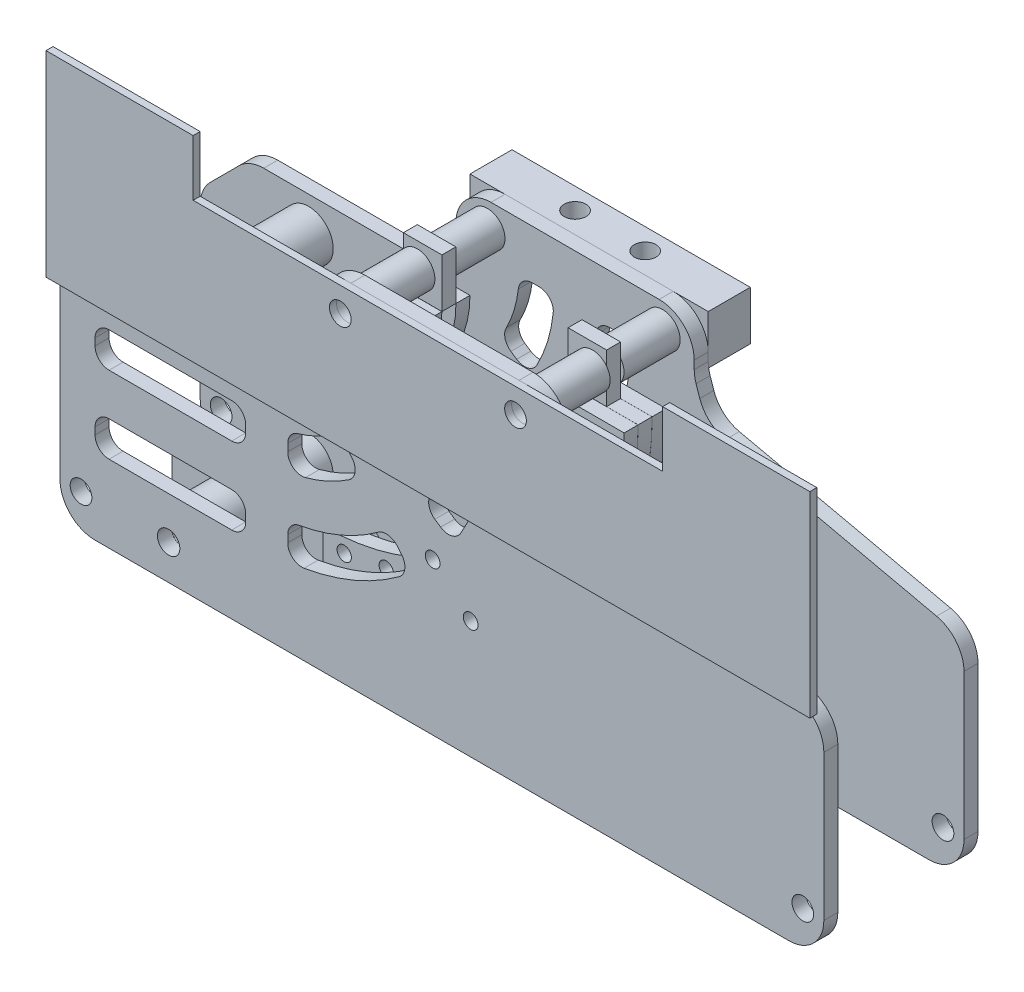
from build123d import *

# Parameters (mm, degrees)
SKETCH_2_R                = 1.025
SKETCH_2_R_2              = 1.25
EXTRUDE_1_DEPTH           = 3
EXTRUDE_1_2_DEPTH         = 3
EXTRUDE_START             = 9
SKETCH_5_R                = 1.55
EXTRUDE_2_DEPTH           = 2
SKETCH_7_W                = 5.5
SKETCH_7_H                = 7
SKETCH_7_W_2              = 23.5
SKETCH_7_H_2              = 10
EXTRUDE_3_DEPTH           = 1
CUT_EXTRUDE_4_DEPTH       = 91.178988684
CUT_EXTRUDE_4_DEPTH_BACK  = 91.178988684
SKETCH_10_R               = 1.6
EXTRUDE_START_2           = -20
SKETCH_11_R               = 3.5
SKETCH_11_R_2             = 1.6
EXTRUDE_4_DEPTH           = 18
CUT_EXTRUDE_7_DEPTH       = 91.178988684
CUT_EXTRUDE_7_DEPTH_BACK  = 91.178988684
SKETCH_6_W                = 242.944287764
SKETCH_6_H                = 0.01
SKETCH_6_W_2              = 242.219741481
SKETCH_6_W_3              = 238.330036414
CUT_EXTRUDE_8_DEPTH       = 1
CUT_EXTRUDE_9_DEPTH       = 91.178988684
CUT_EXTRUDE_9_DEPTH_BACK  = 100.178988684
CUT_EXTRUDE_9_START       = 9
SKETCH_18_R               = 1.55
SKETCH_19_R               = 2.5
SKETCH_19_R_2             = 1.55
EXTRUDE_9_DEPTH           = 8
EXTRUDE_9_2_DEPTH         = 8
EXTRUDE_START_3           = 9.99
SKETCH_19_2_R             = 2.5
SKETCH_19_2_R_2           = 1.55
EXTRUDE_10_DEPTH          = 8.01
EXTRUDE_10_2_DEPTH        = 8.01
SKETCH_20_W               = 38
SKETCH_20_H               = 7
SKETCH_20_R               = 1.2
EXTRUDE_11_DEPTH          = 6
SKETCH_21_R               = 1.55
CUT_EXTRUDE_10_DEPTH      = 92.105707834
CUT_EXTRUDE_START         = -29
CUT_EXTRUDE_11_OUTLINE_W  = 2
CUT_EXTRUDE_11_OUTLINE_H  = 7
CUT_EXTRUDE_11_DEPTH      = 8
CUT_EXTRUDE_START_2       = -23
CUT_EXTRUDE_11_2_DEPTH    = 4
CUT_EXTRUDE_START_3       = -3
CUT_EXTRUDE_11_3_DEPTH    = 4
CUT_EXTRUDE_12_DEPTH      = 94.782994194
CUT_EXTRUDE_12_DEPTH_BACK = 94.782994194
SKETCH_23_R               = 1.05
SKETCH_25_W               = 21.5
SKETCH_25_H               = 5
CUT_EXTRUDE_13_DEPTH      = 94.782994194
SKETCH_25_3_W             = 21.5
SKETCH_25_3_H             = 5
CUT_EXTRUDE_16_DEPTH      = 94.782994194
FILLET_6_R                = 2
FILLET_7_R                = 2
EXTRUDE_14_DEPTH          = 15
SKETCH_28_R               = 1.15
CUT_EXTRUDE_15_DEPTH      = 15
CUT_EXTRUDE_17_DEPTH      = 2
FILLET_8_R                = 1
SKETCH_30_R               = 1.55
EXTRUDE_15_DEPTH          = 1
CUT_EXTRUDE_START_4       = -17
SKETCH_31_R               = 1.6
CUT_EXTRUDE_18_DEPTH      = 17
SKETCH_32_W               = 9
SKETCH_32_H               = 9
CUT_EXTRUDE_19_DEPTH      = 95.740097074
SKETCH_33_W               = 7
SKETCH_33_H               = 10
CUT_EXTRUDE_20_DEPTH      = 1.99
CUT_EXTRUDE_21_DEPTH      = 95.740097046
CUT_EXTRUDE_21_DEPTH_BACK = 95.740097046
SKETCH_34_W               = 1
SKETCH_34_H               = 32
EXTRUDE_16_DEPTH          = 2
EXTRUDE_START_4           = -9
EXTRUDE_17_DEPTH          = 2
FILLET_9_R                = 5
FILLET_10_R               = 5


with BuildPart() as part:
    # 草图2 → 凸台-拉伸1 (new, symmetric)
    with BuildSketch(Plane.XY):
        with BuildLine():
            Line((0, -5), (0, -15))
            ThreePointArc((0, -15), (10.606601718, -10.606601718), (15, 0))
            Line((15, 0), (5, 0))
            ThreePointArc((5, 0), (3.535533906, -3.535533906), (0, -5))
        make_face()
        with Locations((12.291741483, -4.232386008)):
            Circle(SKETCH_2_R, mode=Mode.SUBTRACT)
        with Locations((9.507598121, -8.865978681)):
            Circle(SKETCH_2_R, mode=Mode.SUBTRACT)
        with Locations((5.07950467, -11.966563095)):
            Circle(SKETCH_2_R, mode=Mode.SUBTRACT)
        with Locations((3.5, -7.745966692)):
            Circle(SKETCH_2_R_2, mode=Mode.SUBTRACT)
        with Locations((7.745966692, -3.5)):
            Circle(SKETCH_2_R_2, mode=Mode.SUBTRACT)
    extrude(amount=EXTRUDE_1_DEPTH, both=True)



with BuildPart() as body_2:
    # 草图2 → Extrude 1 2 (new, symmetric)
    with BuildSketch(Plane.XY):
        with BuildLine():
            Line((33, 0), (43, 0))
            ThreePointArc((43, 0), (30.405591591, -30.405591591), (0, -43))
            Line((0, -43), (0, -33))
            ThreePointArc((0, -33), (23.334523779, -23.334523779), (33, 0))
        make_face()
        with Locations((34.866814433, -3.050450996)):
            Circle(SKETCH_2_R, mode=Mode.SUBTRACT)
        with Locations((33.80740392, -9.058666579)):
            Circle(SKETCH_2_R, mode=Mode.SUBTRACT)
        with Locations((31.720772546, -14.791639161)):
            Circle(SKETCH_2_R, mode=Mode.SUBTRACT)
        with Locations((28.67032155, -20.075175272)):
            Circle(SKETCH_2_R, mode=Mode.SUBTRACT)
        with Locations((24.748737342, -24.748737342)):
            Circle(SKETCH_2_R, mode=Mode.SUBTRACT)
        with Locations((20.075175272, -28.67032155)):
            Circle(SKETCH_2_R, mode=Mode.SUBTRACT)
        with Locations((14.791639161, -31.720772546)):
            Circle(SKETCH_2_R, mode=Mode.SUBTRACT)
        with Locations((9.058666579, -33.80740392)):
            Circle(SKETCH_2_R, mode=Mode.SUBTRACT)
        with Locations((3.050450996, -34.866814433)):
            Circle(SKETCH_2_R, mode=Mode.SUBTRACT)
        with Locations((7, -39.382737335)):
            Circle(SKETCH_2_R_2, mode=Mode.SUBTRACT)
        with Locations((39.382737335, -7)):
            Circle(SKETCH_2_R_2, mode=Mode.SUBTRACT)
        with Locations((31.382737335, -24.801689405)):
            Circle(SKETCH_2_R_2, mode=Mode.SUBTRACT)
    extrude(amount=EXTRUDE_1_2_DEPTH, both=True)


with BuildPart() as body_3:
    # 草图5 → 凸台-拉伸2 (new body)
    with BuildSketch(Plane.XY.offset(EXTRUDE_START)):
        with BuildLine():
            Line((-22.5, -5), (0, -5))
            ThreePointArc((0, -5), (3.535533906, -3.535533906), (5, 0))
            Line((5, 0), (5, 7))
            Line((5, 7), (43, 7))
            Line((43, 7), (43, 0))
            ThreePointArc((43, 0), (42.927016315, -2.504250452), (42.708313008, -5))
            Line((42.708313008, -5), (78.5, -13))
            Line((78.5, -13), (78.5, -43))
            Line((78.5, -43), (-30.5, -43))
            Line((-30.5, -43), (-30.5, -13))
            Line((-30.5, -13), (-22.5, -5))
        make_face()
        with Locations((-26.5, -38)):
            Circle(SKETCH_5_R, mode=Mode.SUBTRACT)
        with Locations((76.5, -38)):
            Circle(SKETCH_5_R, mode=Mode.SUBTRACT)
    extrude(amount=EXTRUDE_2_DEPTH)


with BuildPart() as body_4:
    # 镜向8: mirrored copy
    add(body_3.part.mirror(Plane.XY))


with BuildPart() as part_1:
    add(part.part)

    add(body_2.part)  # 凸台-拉伸3 merges body 2
    # 草图7 → 凸台-拉伸3 (add, symmetric)
    with BuildSketch(Plane.XY):
        with Locations((12.25, 3.5)):
            Rectangle(SKETCH_7_W, SKETCH_7_H)
        Polygon((0, -15), (-23.5, -15), (-30.5, -15), (-30.5, -5), (-23.5, -5), (0, -5), align=None)
        with Locations((-11.75, -38)):
            Rectangle(SKETCH_7_W_2, SKETCH_7_H_2)
        with Locations((35.75, 3.5)):
            Rectangle(SKETCH_7_W, SKETCH_7_H)
    extrude(amount=EXTRUDE_3_DEPTH, both=True)


with BuildPart() as cut_extrude_4_tool:
    # 草图10 → 切除-拉伸4 (new, two sides: drawn at the far end of the back side and taken through both)
    with BuildSketch(Plane.XY.offset(-CUT_EXTRUDE_4_DEPTH_BACK)):
        with Locations((-14, -10)):
            Circle(SKETCH_10_R)
        with Locations((-14, -38)):
            Circle(SKETCH_10_R)
    extrude(amount=CUT_EXTRUDE_4_DEPTH + CUT_EXTRUDE_4_DEPTH_BACK)


with BuildPart() as part_2:
    add(part_1.part)

    # 切除-拉伸4: cut by cut_extrude_4_tool
    add(cut_extrude_4_tool.part, mode=Mode.SUBTRACT)



with BuildPart() as body_3_1:
    add(body_3.part)

    # 切除-拉伸4: cut by cut_extrude_4_tool
    add(cut_extrude_4_tool.part, mode=Mode.SUBTRACT)


with BuildPart() as body_4_1:
    add(body_4.part)

    # 切除-拉伸4: cut by cut_extrude_4_tool
    add(cut_extrude_4_tool.part, mode=Mode.SUBTRACT)


with BuildPart() as part_3:
    add(part_2.part)

    add(body_3_1.part)  # 凸台-拉伸4 merges body 3

    add(body_4_1.part)  # 凸台-拉伸4 merges body 4
    # 草图11 → 凸台-拉伸4 (add)
    # profile 1 of 2: a face of its own
    with BuildSketch(Plane.XY.offset(11).offset(EXTRUDE_START_2)):
        with Locations((-14, -10)):
            Circle(SKETCH_11_R)
        with Locations((-14, -10)):
            Circle(SKETCH_11_R_2, mode=Mode.SUBTRACT)
    # profile 2 of 2: a face of its own
    with BuildSketch(Plane.XY.offset(11).offset(EXTRUDE_START_2)):
        with Locations((-14, -38)):
            Circle(SKETCH_11_R)
        with Locations((-14, -38)):
            Circle(SKETCH_11_R_2, mode=Mode.SUBTRACT)
    extrude(amount=EXTRUDE_4_DEPTH)

    # 草图6 → 切除-拉伸7 (cut, two sides: drawn at the far end of the back side and taken through both)
    with BuildSketch(Plane(origin=(0, 0, 0), x_dir=(1, 0, 0), z_dir=(0, 1, 0)).offset(-CUT_EXTRUDE_7_DEPTH_BACK)):
        with Locations((30.547592509, -8.995)):
            Rectangle(SKETCH_6_W, SKETCH_6_H)
        with Locations((30.909865651, 8.995)):
            Rectangle(SKETCH_6_W_2, SKETCH_6_H)
        with Locations((32.854718184, 0.995)):
            Rectangle(SKETCH_6_W_3, SKETCH_6_H)
        with Locations((32.854718184, -1.005)):
            Rectangle(SKETCH_6_W_3, SKETCH_6_H)
    extrude(amount=CUT_EXTRUDE_7_DEPTH + CUT_EXTRUDE_7_DEPTH_BACK, mode=Mode.SUBTRACT)


with BuildPart() as cut_extrude_7_piece_1:
    # of the separate pieces the step leaves, piece 1, a body of its own (cut_extrude_7_pieces)
    add(part_3.part.solids().sort_by_distance((-22.5, -5, 9))[0])


with BuildPart() as cut_extrude_7_piece_2:
    # of the separate pieces the step leaves, piece 2, a body of its own (cut_extrude_7_pieces)
    add(part_3.part.solids().sort_by_distance((-12.4, -38, -9))[0])


with BuildPart() as cut_extrude_7_piece_3:
    # of the separate pieces the step leaves, piece 3, a body of its own (cut_extrude_7_pieces)
    add(part_3.part.solids().sort_by_distance((0, -43, 1))[0])


with BuildPart() as cut_extrude_7_piece_4:
    # of the separate pieces the step leaves, piece 4, a body of its own (cut_extrude_7_pieces)
    add(part_3.part.solids().sort_by_distance((43, 0, -3))[0])


with BuildPart() as cut_extrude_7_piece_5:
    # of the separate pieces the step leaves, piece 5, a body of its own (cut_extrude_7_pieces)
    add(part_3.part.solids().sort_by_distance((0, -43, 1.01))[0])


with BuildPart() as cut_extrude_7_piece_6:
    # of the separate pieces the step leaves, piece 6, a body of its own (cut_extrude_7_pieces)
    add(part_3.part.solids().sort_by_distance((0, -15, 1))[0])


with BuildPart() as cut_extrude_7_piece_7:
    # of the separate pieces the step leaves, piece 7, a body of its own (cut_extrude_7_pieces)
    add(part_3.part.solids().sort_by_distance((0, -15, -1))[0])


with BuildPart() as cut_extrude_7_piece_8:
    # of the separate pieces the step leaves, piece 8, a body of its own (cut_extrude_7_pieces)
    add(part_3.part.solids().sort_by_distance((0, -5, 1.01))[0])


with BuildPart() as cut_extrude_7_piece_9:
    # of the separate pieces the step leaves, piece 9, a body of its own (cut_extrude_7_pieces)
    add(part_3.part.solids().sort_by_distance((-12.4, -38, -1))[0])


with BuildPart() as cut_extrude_7_piece_10:
    # of the separate pieces the step leaves, piece 10, a body of its own (cut_extrude_7_pieces)
    add(part_3.part.solids().sort_by_distance((-10.5, -10, -8.99))[0])


with BuildPart() as cut_extrude_7_piece_11:
    # of the separate pieces the step leaves, piece 11, a body of its own (cut_extrude_7_pieces)
    add(part_3.part.solids().sort_by_distance((-10.5, -38, 1.01))[0])


with BuildPart() as cut_extrude_7_piece_12:
    # of the separate pieces the step leaves, piece 12, a body of its own (cut_extrude_7_pieces)
    add(part_3.part.solids().sort_by_distance((-10.5, -10, 1.01))[0])


with BuildPart() as cut_extrude_8_tool:
    # 草图8 → 切除-拉伸8 (new, symmetric)
    with BuildSketch(Plane.XY):
        with BuildLine():
            Line((10, 0), (15, 0))
            ThreePointArc((15, 0), (10.606601718, -10.606601718), (0, -15))
            Line((0, -15), (0, -10))
            ThreePointArc((0, -10), (7.071067812, -7.071067812), (10, 0))
        make_face()
        with BuildLine():
            Line((0, -38), (0, -33))
            ThreePointArc((0, -33), (23.334523779, -23.334523779), (33, 0))
            Line((33, 0), (38, 0))
            ThreePointArc((38, 0), (26.870057685, -26.870057685), (0, -38))
        make_face()
    extrude(amount=CUT_EXTRUDE_8_DEPTH, both=True)


with BuildPart() as cut_extrude_7_piece_3_1:
    add(cut_extrude_7_piece_3.part)

    # 切除-拉伸8: cut by cut_extrude_8_tool
    add(cut_extrude_8_tool.part, mode=Mode.SUBTRACT)


with BuildPart() as cut_extrude_7_piece_6_1:
    add(cut_extrude_7_piece_6.part)

    # 切除-拉伸8: cut by cut_extrude_8_tool
    add(cut_extrude_8_tool.part, mode=Mode.SUBTRACT)


with BuildPart() as cut_extrude_9_tool:
    # 草图18 → 切除-拉伸9 (new, two sides: drawn at the far end of the back side and taken through both)
    with BuildSketch(Plane.XY.offset(CUT_EXTRUDE_9_START - CUT_EXTRUDE_9_DEPTH_BACK)):
        with Locations((11.5, 3.5)):
            Circle(SKETCH_18_R)
        with Locations((36.5, 3.5)):
            Circle(SKETCH_18_R)
    extrude(amount=CUT_EXTRUDE_9_DEPTH + CUT_EXTRUDE_9_DEPTH_BACK)


with BuildPart() as cut_extrude_7_piece_1_1:
    add(cut_extrude_7_piece_1.part)

    # 切除-拉伸9: cut by cut_extrude_9_tool
    add(cut_extrude_9_tool.part, mode=Mode.SUBTRACT)

    # Cut-Extrude 11 3 outline → Cut-Extrude 11 3 (cut)
    with BuildSketch(Plane.XY.offset(11).offset(CUT_EXTRUDE_START_3)):
        with BuildLine():
            Line((43, 7), (41, 7))
            Line((41, 7), (41, 0))
            Line((41, 0), (42.708313008, -5))
            ThreePointArc((42.708313008, -5), (42.927016315, -2.504250452), (43, 0))
            Line((43, 0), (43, 7))
        make_face()
        with BuildLine():
            Line((7, 0), (7, 7))
            Line((7, 7), (5, 7))
            Line((5, 7), (5, 0))
            ThreePointArc((5, 0), (4.638584663, -1.866422334), (3.606587069, -3.463023205))
            Line((3.606587069, -3.463023205), (7, 0))
        make_face()
    extrude(amount=CUT_EXTRUDE_11_3_DEPTH, mode=Mode.SUBTRACT)


with BuildPart() as cut_extrude_7_piece_2_1:
    add(cut_extrude_7_piece_2.part)

    # 切除-拉伸9: cut by cut_extrude_9_tool
    add(cut_extrude_9_tool.part, mode=Mode.SUBTRACT)

    # Cut-Extrude 11 2 outline → Cut-Extrude 11 2 (cut)
    with BuildSketch(Plane.XY.offset(11).offset(CUT_EXTRUDE_START_2)):
        with BuildLine():
            Line((43, 7), (41, 7))
            Line((41, 7), (41, 0))
            Line((41, 0), (42.708313008, -5))
            ThreePointArc((42.708313008, -5), (42.927016315, -2.504250452), (43, 0))
            Line((43, 0), (43, 7))
        make_face()
        with BuildLine():
            Line((7, 0), (7, 7))
            Line((7, 7), (5, 7))
            Line((5, 7), (5, 0))
            ThreePointArc((5, 0), (4.638584663, -1.866422334), (3.606587069, -3.463023205))
            Line((3.606587069, -3.463023205), (7, 0))
        make_face()
    extrude(amount=CUT_EXTRUDE_11_2_DEPTH, mode=Mode.SUBTRACT)


with BuildPart() as cut_extrude_7_piece_3_2:
    add(cut_extrude_7_piece_3_1.part)

    # 切除-拉伸9: cut by cut_extrude_9_tool
    add(cut_extrude_9_tool.part, mode=Mode.SUBTRACT)


with BuildPart() as cut_extrude_7_piece_6_2:
    add(cut_extrude_7_piece_6_1.part)

    # 切除-拉伸9: cut by cut_extrude_9_tool
    add(cut_extrude_9_tool.part, mode=Mode.SUBTRACT)

    # 草图33 → 切除-拉伸20 (cut)
    with BuildSketch(Plane.XY.offset(1)):
        with Locations((-27, -10)):
            Rectangle(SKETCH_33_W, SKETCH_33_H)
    extrude(amount=-CUT_EXTRUDE_20_DEPTH, mode=Mode.SUBTRACT)


with BuildPart() as body_13:
    # 草图19 → 凸台-拉伸9 (new body)
    with BuildSketch(Plane(origin=(0, 0, 9), x_dir=(-1, 0, 0), z_dir=(0, 0, -1))):
        with Locations((-11.5, 3.5)):
            Circle(SKETCH_19_R)
        with Locations((-11.5, 3.5)):
            Circle(SKETCH_19_R_2, mode=Mode.SUBTRACT)
    extrude(amount=EXTRUDE_9_DEPTH)


with BuildPart() as body_14:
    # 草图19 → Extrude 9 2 (new body)
    with BuildSketch(Plane(origin=(0, 0, 9), x_dir=(-1, 0, 0), z_dir=(0, 0, -1))):
        with Locations((-36.5, 3.5)):
            Circle(SKETCH_19_R)
        with Locations((-36.5, 3.5)):
            Circle(SKETCH_19_R_2, mode=Mode.SUBTRACT)
    extrude(amount=EXTRUDE_9_2_DEPTH)


with BuildPart() as body_15:
    # 草图19<2> → 凸台-拉伸10 (new body)
    with BuildSketch(Plane(origin=(0, 0, 9), x_dir=(-1, 0, 0), z_dir=(0, 0, -1)).offset(EXTRUDE_START_3)):
        with Locations(Location((-11.5, 3.5, 0), (0, 0, 180))):
            Circle(SKETCH_19_2_R)
        with Locations(Location((-11.5, 3.5, 0), (0, 0, 180))):
            Circle(SKETCH_19_2_R_2, mode=Mode.SUBTRACT)
    extrude(amount=EXTRUDE_10_DEPTH)


with BuildPart() as body_16:
    # 草图19<2> → Extrude 10 2 (new body)
    with BuildSketch(Plane(origin=(0, 0, 9), x_dir=(-1, 0, 0), z_dir=(0, 0, -1)).offset(EXTRUDE_START_3)):
        with Locations(Location((-36.5, 3.5, 0), (0, 0, 180))):
            Circle(SKETCH_19_2_R)
        with Locations(Location((-36.5, 3.5, 0), (0, 0, 180))):
            Circle(SKETCH_19_2_R_2, mode=Mode.SUBTRACT)
    extrude(amount=EXTRUDE_10_2_DEPTH)


with BuildPart() as body_17:
    # 草图20 → 凸台-拉伸11 (new body)
    with BuildSketch(Plane(origin=(0, 0, -11), x_dir=(-1, 0, 0), z_dir=(0, 0, -1))):
        with Locations((-24, 3.5)):
            Rectangle(SKETCH_20_W, SKETCH_20_H)
        with Locations((-11.5, 3.5)):
            Circle(SKETCH_20_R, mode=Mode.SUBTRACT)
        with Locations((-36.5, 3.5)):
            Circle(SKETCH_20_R, mode=Mode.SUBTRACT)
    extrude(amount=EXTRUDE_11_DEPTH)

    # 草图21 → 切除-拉伸10 (cut, through all)
    with BuildSketch(Plane.XZ):
        with Locations(Location((19, -14, 0), (0, 0, 270))):
            Circle(SKETCH_21_R)
        with Locations(Location((29, -14, 0), (0, 0, 90))):
            Circle(SKETCH_21_R)
    extrude(amount=-CUT_EXTRUDE_10_DEPTH, mode=Mode.SUBTRACT)

    # 切除-拉伸11: read off the stored shape, not the designer's step
    # 切除-拉伸11 outline → 切除-拉伸11 (cut)
    with BuildSketch(Plane.XY.offset(11).offset(CUT_EXTRUDE_START)):
        with Locations((6, 3.5)):
            Rectangle(CUT_EXTRUDE_11_OUTLINE_W, CUT_EXTRUDE_11_OUTLINE_H)
        with Locations((42, 3.5)):
            Rectangle(CUT_EXTRUDE_11_OUTLINE_W, CUT_EXTRUDE_11_OUTLINE_H)
    extrude(amount=CUT_EXTRUDE_11_DEPTH, mode=Mode.SUBTRACT)


with BuildPart() as cut_extrude_12_tool:
    # 草图23 → 切除-拉伸12 (new, two sides: drawn at the far end of the back side and taken through both)
    with BuildSketch(Plane.XY.offset(11).offset(-CUT_EXTRUDE_12_DEPTH_BACK)):
        with Locations(Location((29.102644739, -26.186992366, 0), (0, 0, 180))):
            Circle(SKETCH_23_R)
        with Locations(Location((23.676097955, -21.304104901, 0), (0, 0, 180))):
            Circle(SKETCH_23_R)
    extrude(amount=CUT_EXTRUDE_12_DEPTH + CUT_EXTRUDE_12_DEPTH_BACK)


with BuildPart() as cut_extrude_7_piece_1_2:
    add(cut_extrude_7_piece_1_1.part)

    # 切除-拉伸12: cut by cut_extrude_12_tool
    add(cut_extrude_12_tool.part, mode=Mode.SUBTRACT)

    # 草图25 → 切除-拉伸13 (cut, through all)
    with BuildSketch(Plane.XY.offset(11)):
        with BuildLine():
            Line((13.267512535, -8.942768651), (17.413610202, -11.737383854))
            ThreePointArc((17.413610202, -11.737383854), (20.083398794, -6.136537532), (21, 0))
            Line((21, 0), (16, 0))
            ThreePointArc((16, 0), (15.301637176, -4.675457167), (13.267512535, -8.942768651))
        make_face()
        with BuildLine():
            ThreePointArc((27, 0), (25.821512735, -7.88983397), (22.388927402, -15.090922098))
            Line((22.388927402, -15.090922098), (26.535025069, -17.885537302))
            ThreePointArc((26.535025069, -17.885537302), (30.603274353, -9.350914334), (32, 0))
            Line((32, 0), (27, 0))
        make_face()
        with BuildLine():
            ThreePointArc((17.361996461, -20.677550118), (10.636002475, -24.816838061), (3, -26.83281573))
            Line((3, -26.83281573), (3, -31.859064644))
            ThreePointArc((3, -31.859064644), (12.348485191, -29.521431427), (20.577180991, -24.506726066))
            Line((20.577180991, -24.506726066), (17.361996461, -20.677550118))
        make_face()
        with BuildLine():
            Line((3, -15.716233646), (3, -20.784609691))
            ThreePointArc((3, -20.784609691), (8.580268921, -19.167132943), (13.503775025, -16.082538981))
            Line((13.503775025, -16.082538981), (10.288590495, -12.253363033))
            ThreePointArc((10.288590495, -12.253363033), (6.866187265, -14.45183284), (3, -15.716233646))
        make_face()
        with Locations((-13.75, -29.5)):
            Rectangle(SKETCH_25_W, SKETCH_25_H)
        with Locations((-13.75, -18.5)):
            Rectangle(SKETCH_25_W, SKETCH_25_H)
    extrude(amount=-CUT_EXTRUDE_13_DEPTH, mode=Mode.SUBTRACT)

    # 圆角6
    fillet_6_edges = [cut_extrude_7_piece_1_2.edges().sort_by_distance(p)[0] for p in [
        (-24.5, -27, 10),
        (-3, -27, 10),
        (-3, -32, 10),
        (-24.5, -32, 10),
        (3, -15.716233646, 10),
        (10.288590495, -12.253363033, 10),
        (13.503775025, -16.082538981, 10),
        (3, -20.784609691, 10),
        (3, -31.859064644, 10),
        (3, -26.83281573, 10),
        (17.361996461, -20.677550118, 10),
        (20.577180991, -24.506726066, 10),
        (26.535025069, -17.885537302, 10),
        (22.388927402, -15.090922098, 10),
        (27, 0, 10),
        (32, 0, 10),
        (-24.5, -16, 10),
        (-3, -16, 10),
        (-3, -21, 10),
        (-24.5, -21, 10),
        (13.267512535, -8.942768651, 10),
        (16, 0, 10),
        (21, 0, 10),
        (17.413610202, -11.737383854, 10),
    ]]
    fillet(fillet_6_edges, radius=FILLET_6_R)


with BuildPart() as cut_extrude_7_piece_2_2:
    add(cut_extrude_7_piece_2_1.part)

    # 切除-拉伸12: cut by cut_extrude_12_tool
    add(cut_extrude_12_tool.part, mode=Mode.SUBTRACT)

    # 草图25<3> → 切除-拉伸16 (cut, through all)
    with BuildSketch(Plane.XY.offset(11)):
        with Locations((-13.75, -18.5)):
            Rectangle(SKETCH_25_3_W, SKETCH_25_3_H)
        with Locations((-13.75, -29.5)):
            Rectangle(SKETCH_25_3_W, SKETCH_25_3_H)
        with BuildLine():
            Line((13.267512535, -8.942768651), (17.413610202, -11.737383854))
            ThreePointArc((17.413610202, -11.737383854), (20.083398794, -6.136537532), (21, 0))
            Line((21, 0), (16, 0))
            ThreePointArc((16, 0), (15.301637176, -4.675457167), (13.267512535, -8.942768651))
        make_face()
        with BuildLine():
            ThreePointArc((27, 0), (25.821512735, -7.88983397), (22.388927402, -15.090922098))
            Line((22.388927402, -15.090922098), (26.535025069, -17.885537302))
            ThreePointArc((26.535025069, -17.885537302), (30.603274353, -9.350914334), (32, 0))
            Line((32, 0), (27, 0))
        make_face()
    extrude(amount=-CUT_EXTRUDE_16_DEPTH, mode=Mode.SUBTRACT)

    # 圆角7
    fillet_7_edges = [cut_extrude_7_piece_2_2.edges().sort_by_distance(p)[0] for p in [
        (26.535025069, -17.885537302, -10),
        (22.388927402, -15.090922098, -10),
        (27, 0, -10),
        (32, 0, -10),
        (13.267512535, -8.942768651, -10),
        (16, 0, -10),
        (21, 0, -10),
        (17.413610202, -11.737383854, -10),
        (-24.5, -27, -10),
        (-3, -27, -10),
        (-3, -32, -10),
        (-24.5, -32, -10),
        (-24.5, -16, -10),
        (-3, -16, -10),
        (-3, -21, -10),
        (-24.5, -21, -10),
    ]]
    fillet(fillet_7_edges, radius=FILLET_7_R)

    # 草图29 → 切除-拉伸17 (cut)
    with BuildSketch(Plane(origin=(0, 0, -11), x_dir=(-1, 0, 0), z_dir=(0, 0, -1))):
        Polygon((-16.061771025, -20.669530995), (-13.745594554, -17.165914783), (-7.906234202, -21.026208901), (-10.222410673, -24.529825112), align=None)
    extrude(amount=-CUT_EXTRUDE_17_DEPTH, mode=Mode.SUBTRACT)

    # 圆角8
    fillet_8_edges = [cut_extrude_7_piece_2_2.edges().sort_by_distance(p)[0] for p in [
        (10.222410673, -24.529825112, -10),
        (16.061771025, -20.669530995, -10),
        (13.745594554, -17.165914783, -10),
        (7.906234202, -21.026208901, -10),
    ]]
    fillet(fillet_8_edges, radius=FILLET_8_R)


with BuildPart() as body_18:
    # 草图27 → 凸台-拉伸14 (new body)
    with BuildSketch(Plane(origin=(0, 0, -11), x_dir=(-1, 0, 0), z_dir=(0, 0, -1))):
        Polygon((1.683886721, -33.719497705), (-15, -22.690085941), (-23.272058824, -35.203000982), (-6.588172102, -46.232412746), align=None)
    extrude(amount=EXTRUDE_14_DEPTH)

    # 草图28 → 切除-拉伸15 (cut)
    with BuildSketch(Plane(origin=(23.272058824, -35.203000982, 0), x_dir=(0, 0, -1), z_dir=(0.5514705882352942, -0.8341943360581028, 0))):
        with Locations(Location((22.7, -14, 0), (0, 0, 90))):
            Circle(SKETCH_28_R)
        with Locations(Location((22.7, -4.5, 0), (0, 0, 90))):
            Circle(SKETCH_28_R)
    extrude(amount=-CUT_EXTRUDE_15_DEPTH, mode=Mode.SUBTRACT)


with BuildPart() as body_19:
    # 草图30 → 凸台-拉伸15 (new body)
    with BuildSketch(Plane.XY.offset(11)):
        Polygon((-9.5, 7), (57.5, 7), (57.5, 15), (78.5, 15), (78.5, 7), (78.5, -13), (-30.5, -13), (-30.5, 7), (-30.5, 15), (-9.5, 15), align=None)
        with Locations((36.5, 3.5)):
            Circle(SKETCH_30_R, mode=Mode.SUBTRACT)
        with Locations((11.5, 3.5)):
            Circle(SKETCH_30_R, mode=Mode.SUBTRACT)
    extrude(amount=EXTRUDE_15_DEPTH)


with BuildPart() as cut_extrude_18_tool:
    # 草图31 → 切除-拉伸18 (new body)
    with BuildSketch(Plane(origin=(0, 0, -26), x_dir=(-1, 0, 0), z_dir=(0, 0, -1)).offset(CUT_EXTRUDE_START_4)):
        with Locations((-17.446675379, -35.457770915)):
            Circle(SKETCH_31_R)
        with Locations((-9.104732018, -40.972476797)):
            Circle(SKETCH_31_R)
    extrude(amount=CUT_EXTRUDE_18_DEPTH)


with BuildPart() as cut_extrude_7_piece_2_3:
    add(cut_extrude_7_piece_2_2.part)

    # 切除-拉伸18: cut by cut_extrude_18_tool
    add(cut_extrude_18_tool.part, mode=Mode.SUBTRACT)


with BuildPart() as body_18_1:
    add(body_18.part)

    # 切除-拉伸18: cut by cut_extrude_18_tool
    add(cut_extrude_18_tool.part, mode=Mode.SUBTRACT)

    # 草图32 → 切除-拉伸19 (cut, through all)
    with BuildSketch(Plane(origin=(0, 0, 0), x_dir=(0, 0, -1), z_dir=(0.8341943360581027, 0.5514705882352942, 0))):
        with Locations((21.5, -37.7)):
            Rectangle(SKETCH_32_W, SKETCH_32_H)
    extrude(amount=-CUT_EXTRUDE_19_DEPTH, mode=Mode.SUBTRACT)


with BuildPart() as cut_extrude_21_tool:
    # 草图34 → 切除-拉伸21 (new, two sides: drawn at the far end of the back side and taken through both)
    with BuildSketch(Plane.XY.offset(-CUT_EXTRUDE_21_DEPTH_BACK)):
        with Locations((-30, -27)):
            Rectangle(SKETCH_34_W, SKETCH_34_H)
    extrude(amount=CUT_EXTRUDE_21_DEPTH + CUT_EXTRUDE_21_DEPTH_BACK)


with BuildPart() as cut_extrude_7_piece_1_3:
    add(cut_extrude_7_piece_1_2.part)

    # 切除-拉伸21: cut by cut_extrude_21_tool
    add(cut_extrude_21_tool.part, mode=Mode.SUBTRACT)

    # 草图35 → 凸台-拉伸16 (add)
    with BuildSketch(Plane.XY.offset(EXTRUDE_START)):
        Polygon((78.5, -43), (78.5, -13), (79.5, -13.223515589), (79.5, -43), align=None)
    extrude(amount=EXTRUDE_16_DEPTH)

    # 圆角9
    fillet_9_edges = [cut_extrude_7_piece_1_3.edges().sort_by_distance(p)[0] for p in [
        (42.708313008, -5, 10),
        (-22.5, -5, 10),
        (-29.5, -43, 10),
        (-29.5, -12, 10),
        (79.5, -43, 10),
        (79.5, -13.223515589, 10),
        (41, 7, 10),
        (7, 7, 10),
    ]]
    fillet(fillet_9_edges, radius=FILLET_9_R)


with BuildPart() as cut_extrude_7_piece_2_4:
    add(cut_extrude_7_piece_2_3.part)

    # 切除-拉伸21: cut by cut_extrude_21_tool
    add(cut_extrude_21_tool.part, mode=Mode.SUBTRACT)

    # 草图35<2> → 凸台-拉伸17 (add)
    with BuildSketch(Plane.XY.offset(EXTRUDE_START_4)):
        Polygon((78.5, -43), (78.5, -13), (79.5, -13.223515589), (79.5, -43), align=None)
    extrude(amount=-EXTRUDE_17_DEPTH)

    # 圆角10
    fillet_10_edges = [cut_extrude_7_piece_2_4.edges().sort_by_distance(p)[0] for p in [
        (42.708313008, -5, -10),
        (-29.5, -43, -10),
        (-29.5, -12, -10),
        (-22.5, -5, -10),
        (79.5, -43, -10),
        (79.5, -13.223515589, -10),
        (41, 7, -10),
        (41, 0, -10),
        (7, 7, -10),
    ]]
    fillet(fillet_10_edges, radius=FILLET_10_R)


solid = Compound([cut_extrude_7_piece_4.part, cut_extrude_7_piece_5.part, cut_extrude_7_piece_7.part, cut_extrude_7_piece_8.part, cut_extrude_7_piece_9.part, cut_extrude_7_piece_10.part, cut_extrude_7_piece_11.part, cut_extrude_7_piece_12.part, cut_extrude_7_piece_3_2.part, cut_extrude_7_piece_6_2.part, body_13.part, body_14.part, body_15.part, body_16.part, body_17.part, body_19.part, body_18_1.part, cut_extrude_7_piece_1_3.part, cut_extrude_7_piece_2_4.part])
